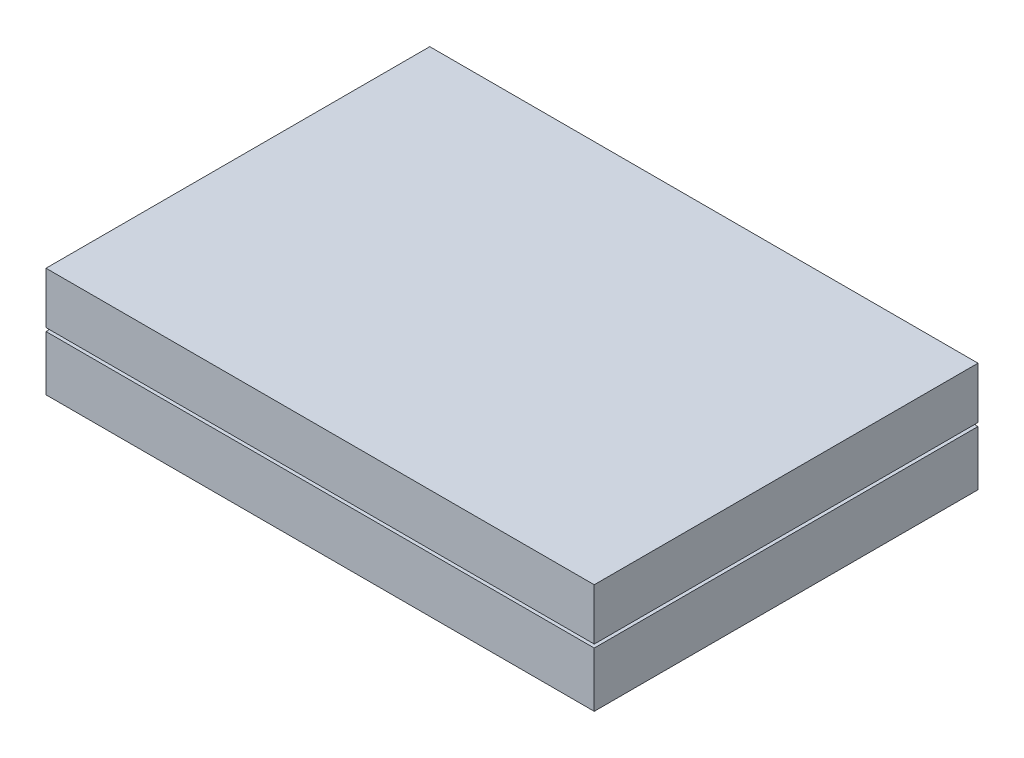
from build123d import *

# Parameters (mm, degrees)
SKETCH1_W                  = 457.2
SKETCH1_H                  = 304.8
BOSS_EXTRUDE1_DEPTH        = 3.175
SKETCH2_W                  = 457.2
SKETCH2_H                  = 266.7
SKETCH2_W_2                = 117.475
SKETCH2_H_2                = 260.35
SKETCH2_W_3                = 103.1875
BOSS_EXTRUDE2_DEPTH        = 6.35
TOOLING_START              = 3.175
TOOLING_SPLIT1_OUTLINE_W   = 508
TOOLING_SPLIT1_OUTLINE_H   = 355.6
TOOLING_SPLIT1_DEPTH       = 50.8
TOOLING_START_2            = -25.4
TOOLING_SPLIT1_2_DEPTH     = 508
TOOLING_START_3            = 109.5375
TOOLING_SPLIT1_3_OUTLINE_W = 6.35
TOOLING_SPLIT1_3_OUTLINE_H = 260.35
TOOLING_SPLIT1_3_DEPTH     = 117.475
TOOLING_START_4            = 230.1875
TOOLING_SPLIT1_4_OUTLINE_W = 6.35
TOOLING_SPLIT1_4_OUTLINE_H = 260.35
TOOLING_SPLIT1_4_DEPTH     = 117.475
TOOLING_SPLIT1_5_OUTLINE_W = 6.35
TOOLING_SPLIT1_5_OUTLINE_H = 260.35
TOOLING_SPLIT1_5_DEPTH     = 103.1875
TOOLING_START_5            = 350.8375
TOOLING_SPLIT1_6_OUTLINE_W = 6.35
TOOLING_SPLIT1_6_OUTLINE_H = 260.35
TOOLING_SPLIT1_6_DEPTH     = 103.1875
TOOLING_SPLIT1_7_DEPTH     = 25.4
TOOLING_START_6            = 457.2
TOOLING_SPLIT1_8_DEPTH     = 25.4
SKETCH6_W                  = 508
SKETCH6_H                  = 355.6
SKETCH6_W_2                = 457.2
SKETCH6_H_2                = 304.8
CUT_EXTRUDE1_DEPTH         = 3.175


# Read off the part's stored shape, not the designer's step: Tooling Split1
with BuildPart() as part:
    # Sketch1 → Boss-Extrude1 (new body)
    with BuildSketch(Plane(origin=(0, 0, 0), x_dir=(1, 0, 0), z_dir=(0, 1, 0))):
        with Locations((228.6, 152.4)):
            Rectangle(SKETCH1_W, SKETCH1_H)
    extrude(amount=BOSS_EXTRUDE1_DEPTH)

    # Sketch2 → Boss-Extrude2 (add)
    with BuildSketch(Plane.XZ):
        with Locations((228.6, -152.4)):
            Rectangle(SKETCH2_W, SKETCH2_H)
        with Locations((168.275, -152.4)):
            Rectangle(SKETCH2_W_2, SKETCH2_H_2, mode=Mode.SUBTRACT)
        with Locations((54.76875, -152.4)):
            Rectangle(SKETCH2_W_3, SKETCH2_H_2, mode=Mode.SUBTRACT)
        with Locations((402.43125, -152.4)):
            Rectangle(SKETCH2_W_3, SKETCH2_H_2, mode=Mode.SUBTRACT)
        with Locations((288.925, -152.4)):
            Rectangle(SKETCH2_W_2, SKETCH2_H_2, mode=Mode.SUBTRACT)
    extrude(amount=BOSS_EXTRUDE2_DEPTH)


with BuildPart() as body_2:
    # Tooling Split1 outline → Tooling Split1 (new body)
    with BuildSketch(Plane(origin=(0, 0, 0), x_dir=(1, 0, 0), z_dir=(0, 1, 0)).offset(TOOLING_START)):
        with Locations((228.6, 152.4)):
            Rectangle(TOOLING_SPLIT1_OUTLINE_W, TOOLING_SPLIT1_OUTLINE_H)
    extrude(amount=TOOLING_SPLIT1_DEPTH)

    # Sketch6 → Cut-Extrude1 (cut)
    with BuildSketch(Plane.XZ.offset(-3.175)):
        with Locations((228.6, -152.4)):
            Rectangle(SKETCH6_W, SKETCH6_H)
        with Locations((228.6, -152.4)):
            Rectangle(SKETCH6_W_2, SKETCH6_H_2, mode=Mode.SUBTRACT)
    extrude(amount=-CUT_EXTRUDE1_DEPTH, mode=Mode.SUBTRACT)


with BuildPart() as body_3:
    # Tooling Split1 2 outline → Tooling Split1 2 (new body)
    with BuildSketch(Plane.YZ.offset(TOOLING_START_2)):
        Polygon((3.175, 0), (3.175, 25.4), (-47.625, 25.4), (-47.625, -330.2), (3.175, -330.2), (3.175, -304.8), (0, -304.8), (0, -285.75), (-6.35, -285.75), (-6.35, -19.05), (0, -19.05), (0, 0), align=None)
    extrude(amount=TOOLING_SPLIT1_2_DEPTH)

    # Tooling Split1 3 outline → Tooling Split1 3 (add)
    with BuildSketch(Plane.YZ.offset(TOOLING_START_3)):
        with Locations((-3.175, -152.4)):
            Rectangle(TOOLING_SPLIT1_3_OUTLINE_W, TOOLING_SPLIT1_3_OUTLINE_H)
    extrude(amount=TOOLING_SPLIT1_3_DEPTH)

    # Tooling Split1 4 outline → Tooling Split1 4 (add)
    with BuildSketch(Plane.YZ.offset(TOOLING_START_4)):
        with Locations((-3.175, -152.4)):
            Rectangle(TOOLING_SPLIT1_4_OUTLINE_W, TOOLING_SPLIT1_4_OUTLINE_H)
    extrude(amount=TOOLING_SPLIT1_4_DEPTH)

    # Tooling Split1 5 outline → Tooling Split1 5 (add)
    with BuildSketch(Plane.YZ.offset(TOOLING_START)):
        with Locations((-3.175, -152.4)):
            Rectangle(TOOLING_SPLIT1_5_OUTLINE_W, TOOLING_SPLIT1_5_OUTLINE_H)
    extrude(amount=TOOLING_SPLIT1_5_DEPTH)

    # Tooling Split1 6 outline → Tooling Split1 6 (add)
    with BuildSketch(Plane.YZ.offset(TOOLING_START_5)):
        with Locations((-3.175, -152.4)):
            Rectangle(TOOLING_SPLIT1_6_OUTLINE_W, TOOLING_SPLIT1_6_OUTLINE_H)
    extrude(amount=TOOLING_SPLIT1_6_DEPTH)

    # Tooling Split1 7 outline → Tooling Split1 7 (add)
    with BuildSketch(Plane.YZ.offset(TOOLING_START_2)):
        Polygon((3.175, -304.8), (3.175, 0), (0, 0), (0, -19.05), (-6.35, -19.05), (-6.35, -285.75), (0, -285.75), (0, -304.8), align=None)
    extrude(amount=TOOLING_SPLIT1_7_DEPTH)

    # Tooling Split1 8 outline → Tooling Split1 8 (add)
    with BuildSketch(Plane.YZ.offset(TOOLING_START_6)):
        Polygon((3.175, -304.8), (3.175, 0), (0, 0), (0, -19.05), (-6.35, -19.05), (-6.35, -285.75), (0, -285.75), (0, -304.8), align=None)
    extrude(amount=TOOLING_SPLIT1_8_DEPTH)


solid = Compound([part.part, body_2.part, body_3.part])
